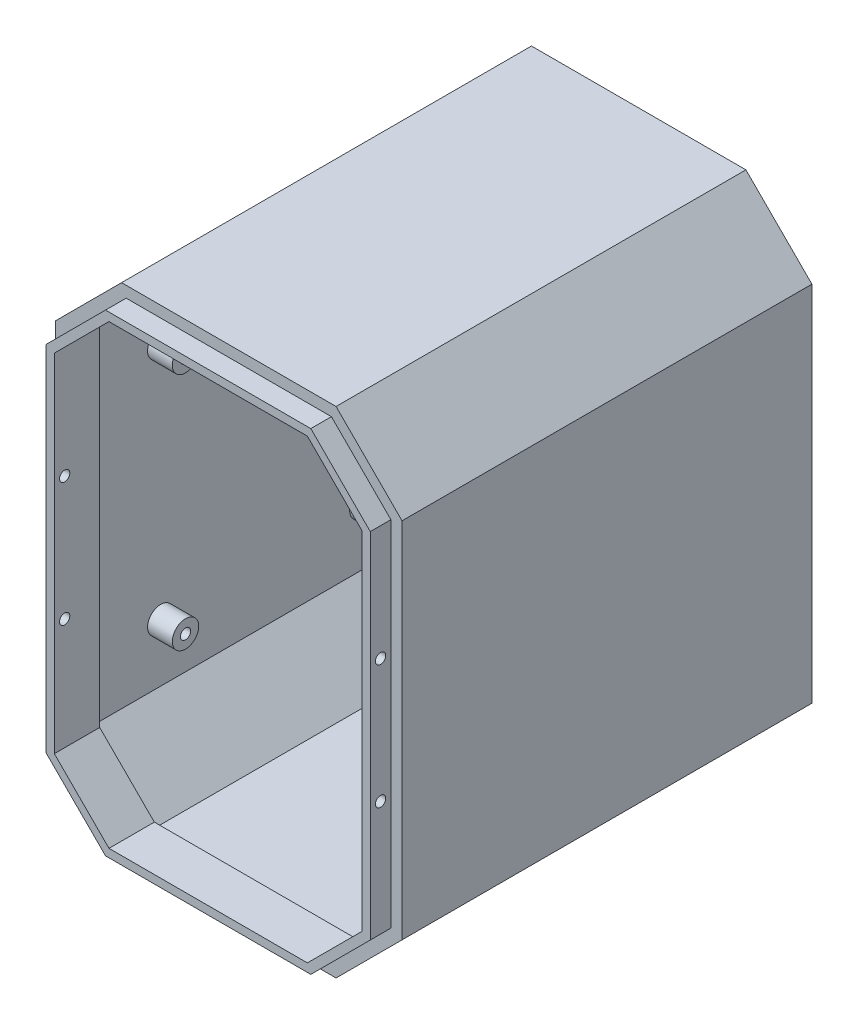
from build123d import *

# Parameters (mm, degrees)
BOSS_1_DEPTH   = 99.375
CUT_2_DEPTH    = 96.975
S_CUT3_W       = 2.7
S_CUT3_H       = 32
POCKET_3_DEPTH = 14
S_HOLE4_R      = 6
HOLE_4_DEPTH   = 2.7
S_HOLE5_R      = 1.6
HOLE_5_DEPTH   = 2.7
S_HOLE6_R      = 1.6
HOLE_6_DEPTH   = 2.7
S_HOLE7_R      = 1.6
HOLE_7_DEPTH   = 2.7
S_HOLE8_R      = 1.6
HOLE_8_DEPTH   = 2.7
BOSS_9_DEPTH   = 6
BOSS_10_DEPTH  = 5.1
S_CYL11_R      = 3.2
BOSS_11_DEPTH  = 6.5
S_CYL12_R      = 3.2
BOSS_12_DEPTH  = 6.5
S_CYL13_R      = 3.2
BOSS_13_DEPTH  = 6.5
S_CYL14_R      = 3.2
BOSS_14_DEPTH  = 6.5
CUT_15_DEPTH   = 11.2
S_HOLE16_R     = 1.25
HOLE_16_DEPTH  = 2.7
S_HOLE17_R     = 1.25
HOLE_17_DEPTH  = 2.7
S_HOLE18_R     = 1.25
HOLE_18_DEPTH  = 2.7
S_HOLE19_R     = 1.25
HOLE_19_DEPTH  = 2.7
S_HOLE20_R     = 1.25
HOLE_20_DEPTH  = 6.1
S_HOLE21_R     = 1.25
HOLE_21_DEPTH  = 6.1
S_HOLE22_R     = 1.25
HOLE_22_DEPTH  = 6.1
S_HOLE23_R     = 1.25
HOLE_23_DEPTH  = 6.1


with BuildPart() as part:
    # S_prism1 → Boss_1 (new body)
    with BuildSketch(Plane.XY.offset(68.625)):
        Polygon((42, -44), (42, 44), (26, 60), (-26, 60), (-42, 44), (-42, -44), (-26, -60), (26, -60), align=None)
    extrude(amount=BOSS_1_DEPTH)

    # S_pcut2 → Cut_2 (cut)
    with BuildSketch(Plane.XY.offset(71.125)):
        Polygon((39.5, -42.964466094), (39.5, 42.964466094), (24.964466094, 57.5), (-24.964466094, 57.5), (-39.5, 42.964466094), (-39.5, -42.964466094), (-24.964466094, -57.5), (24.964466094, -57.5), align=None)
    extrude(amount=CUT_2_DEPTH, mode=Mode.SUBTRACT)

    # S_cut3 → Pocket_3 (cut)
    with BuildSketch(Plane.XY.offset(71.125)):
        with Locations((-40.75, 0)):
            Rectangle(S_CUT3_W, S_CUT3_H)
    extrude(amount=POCKET_3_DEPTH, mode=Mode.SUBTRACT)

    # S_hole4 → Hole_4 (cut)
    with BuildSketch(Plane(origin=(-42.1, 0, 0), x_dir=(0, 0, -1), z_dir=(1, 0, 0))):
        with Locations((-88, 0)):
            Circle(S_HOLE4_R)
    extrude(amount=HOLE_4_DEPTH, mode=Mode.SUBTRACT)

    # S_hole5 → Hole_5 (cut)
    with BuildSketch(Plane.XY.offset(68.525)):
        with Locations((0, -25)):
            Circle(S_HOLE5_R)
    extrude(amount=HOLE_5_DEPTH, mode=Mode.SUBTRACT)

    # S_hole6 → Hole_6 (cut)
    with BuildSketch(Plane.XY.offset(68.525)):
        with Locations((0, 25)):
            Circle(S_HOLE6_R)
    extrude(amount=HOLE_6_DEPTH, mode=Mode.SUBTRACT)

    # S_hole7 → Hole_7 (cut)
    with BuildSketch(Plane.XY.offset(68.525)):
        with Locations((28, -25)):
            Circle(S_HOLE7_R)
    extrude(amount=HOLE_7_DEPTH, mode=Mode.SUBTRACT)

    # S_hole8 → Hole_8 (cut)
    with BuildSketch(Plane.XY.offset(68.525)):
        with Locations((28, 25)):
            Circle(S_HOLE8_R)
    extrude(amount=HOLE_8_DEPTH, mode=Mode.SUBTRACT)

    # S_prism9 → Boss_9 (add)
    with BuildSketch(Plane.XY.offset(162)):
        Polygon((40, -43.171572875), (40, 43.171572875), (25.171572875, 58), (-25.171572875, 58), (-40, 43.171572875), (-40, -43.171572875), (-25.171572875, -58), (25.171572875, -58), align=None)
    extrude(amount=BOSS_9_DEPTH)

    # S_prism10 → Boss_10 (add)
    with BuildSketch(Plane.XY.offset(167.9)):
        Polygon((39.3, -42.881623382), (39.3, 42.881623382), (24.881623382, 57.3), (-24.881623382, 57.3), (-39.3, 42.881623382), (-39.3, -42.881623382), (-24.881623382, -57.3), (24.881623382, -57.3), align=None)
    extrude(amount=BOSS_10_DEPTH)

    # S_cyl11 → Boss_11 (add)
    with BuildSketch(Plane(origin=(-40, 0, 0), x_dir=(0, 0, -1), z_dir=(1, 0, 0))):
        with Locations((-96, -29)):
            Circle(S_CYL11_R)
    extrude(amount=BOSS_11_DEPTH)

    # S_cyl12 → Boss_12 (add)
    with BuildSketch(Plane(origin=(-40, 0, 0), x_dir=(0, 0, -1), z_dir=(1, 0, 0))):
        with Locations((-145, -29)):
            Circle(S_CYL12_R)
    extrude(amount=BOSS_12_DEPTH)

    # S_cyl13 → Boss_13 (add)
    with BuildSketch(Plane(origin=(-40, 0, 0), x_dir=(0, 0, -1), z_dir=(1, 0, 0))):
        with Locations((-96, 29)):
            Circle(S_CYL13_R)
    extrude(amount=BOSS_13_DEPTH)

    # S_cyl14 → Boss_14 (add)
    with BuildSketch(Plane(origin=(-40, 0, 0), x_dir=(0, 0, -1), z_dir=(1, 0, 0))):
        with Locations((-145, 29)):
            Circle(S_CYL14_R)
    extrude(amount=BOSS_14_DEPTH)

    # S_pcut15 → Cut_15 (cut)
    with BuildSketch(Plane.XY.offset(161.9)):
        Polygon((37.3, -42.053196257), (37.3, 42.053196257), (24.053196257, 55.3), (-24.053196257, 55.3), (-37.3, 42.053196257), (-37.3, -42.053196257), (-24.053196257, -55.3), (24.053196257, -55.3), align=None)
    extrude(amount=CUT_15_DEPTH, mode=Mode.SUBTRACT)

    # S_hole16 → Hole_16 (cut)
    with BuildSketch(Plane(origin=(37.1, 0, 0), x_dir=(0, 0, -1), z_dir=(1, 0, 0))):
        with Locations((-170.5, -15)):
            Circle(S_HOLE16_R)
    extrude(amount=HOLE_16_DEPTH, mode=Mode.SUBTRACT)

    # S_hole17 → Hole_17 (cut)
    with BuildSketch(Plane(origin=(37.1, 0, 0), x_dir=(0, 0, -1), z_dir=(1, 0, 0))):
        with Locations((-170.5, 15)):
            Circle(S_HOLE17_R)
    extrude(amount=HOLE_17_DEPTH, mode=Mode.SUBTRACT)

    # S_hole18 → Hole_18 (cut)
    with BuildSketch(Plane(origin=(-39.8, 0, 0), x_dir=(0, 0, -1), z_dir=(1, 0, 0))):
        with Locations((-170.5, -15)):
            Circle(S_HOLE18_R)
    extrude(amount=HOLE_18_DEPTH, mode=Mode.SUBTRACT)

    # S_hole19 → Hole_19 (cut)
    with BuildSketch(Plane(origin=(-39.8, 0, 0), x_dir=(0, 0, -1), z_dir=(1, 0, 0))):
        with Locations((-170.5, 15)):
            Circle(S_HOLE19_R)
    extrude(amount=HOLE_19_DEPTH, mode=Mode.SUBTRACT)

    # S_hole20 → Hole_20 (cut)
    with BuildSketch(Plane(origin=(-39.5, 0, 0), x_dir=(0, 0, -1), z_dir=(1, 0, 0))):
        with Locations((-96, -29)):
            Circle(S_HOLE20_R)
    extrude(amount=HOLE_20_DEPTH, mode=Mode.SUBTRACT)

    # S_hole21 → Hole_21 (cut)
    with BuildSketch(Plane(origin=(-39.5, 0, 0), x_dir=(0, 0, -1), z_dir=(1, 0, 0))):
        with Locations((-145, -29)):
            Circle(S_HOLE21_R)
    extrude(amount=HOLE_21_DEPTH, mode=Mode.SUBTRACT)

    # S_hole22 → Hole_22 (cut)
    with BuildSketch(Plane(origin=(-39.5, 0, 0), x_dir=(0, 0, -1), z_dir=(1, 0, 0))):
        with Locations((-96, 29)):
            Circle(S_HOLE22_R)
    extrude(amount=HOLE_22_DEPTH, mode=Mode.SUBTRACT)

    # S_hole23 → Hole_23 (cut)
    with BuildSketch(Plane(origin=(-39.5, 0, 0), x_dir=(0, 0, -1), z_dir=(1, 0, 0))):
        with Locations((-145, 29)):
            Circle(S_HOLE23_R)
    extrude(amount=HOLE_23_DEPTH, mode=Mode.SUBTRACT)


solid = part.part
